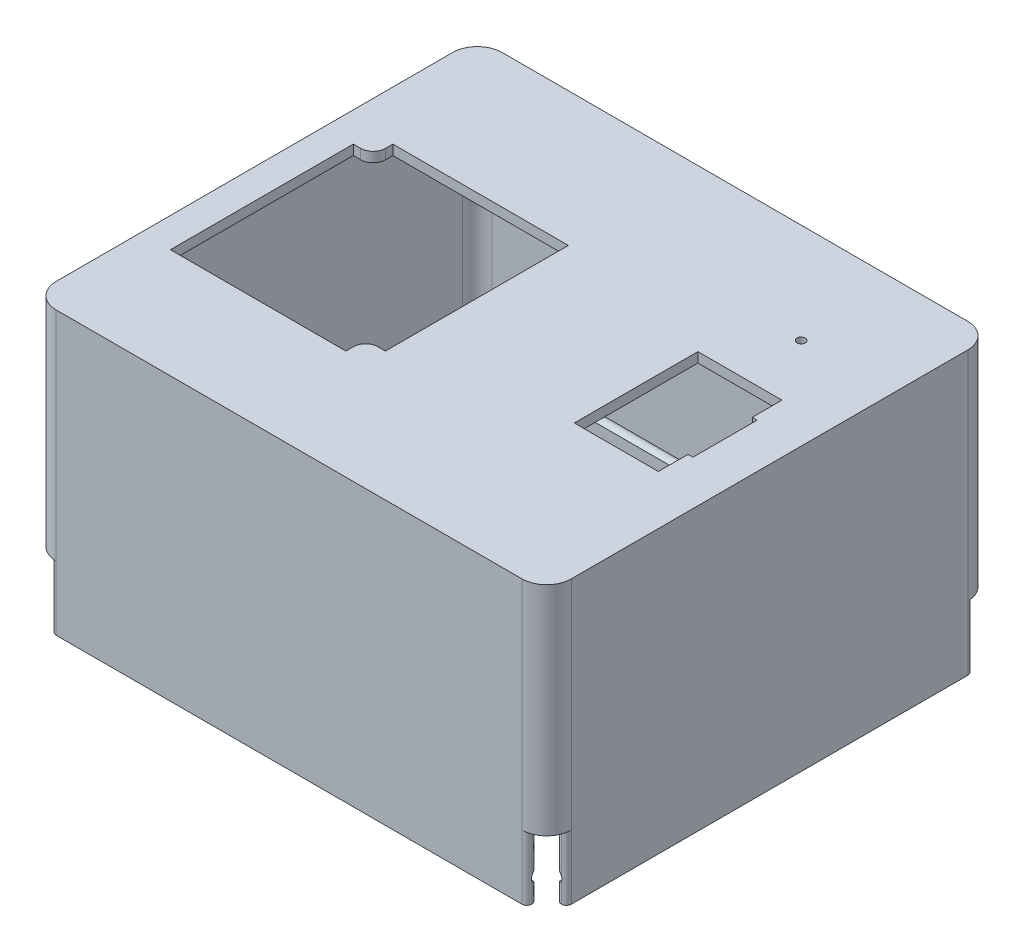
from build123d import *

# Parameters (mm, degrees)
ESQUISSE1_W                     = 104.2
ESQUISSE1_H                     = 90.2
BOSS_EXTRU_1_DEPTH              = 2
ESQUISSE2_W                     = 104.2
ESQUISSE2_H                     = 90.2
ESQUISSE2_W_2                   = 100.2
ESQUISSE2_H_2                   = 86.2
BOSS_EXTRU_2_DEPTH              = 55
ENL_V_MAT_EXTRU_1_DEPTH         = 13
SYM_TRIE2_COPY_1_DEPTH          = 13
CONG_3_R                        = 1
CONG_1_R                        = 5
ENL_V_MAT_EXTRU_2_DEPTH         = 89.167000629
ENL_V_MAT_EXTRU_3_DEPTH         = 89.167000741
ESQUISSE15_W                    = 100.6
ESQUISSE15_H                    = 86.6
ENL_V_MAT_EXTRU_10_DEPTH        = 4.5
ENL_V_MAT_EXTRU_12_REACH        = 90.167
ESQUISSE17_W                    = 39.5
ESQUISSE17_H                    = 41
ESQUISSE19_R                    = 4
BOSS_EXTRU_5_DEPTH              = 9
ESQUISSE20_R                    = 2.05
ENL_V_MAT_EXTRU_13_DEPTH        = 10
R_P_TITION_LIN_AIRE1_COUNT      = 2
R_P_TITION_LIN_AIRE1_PITCH      = 31.8
R_P_TITION_LIN_AIRE1_COUNT_DIR2 = 2
R_P_TITION_LIN_AIRE1_PITCH_DIR2 = 71.5
ENL_V_MAT_EXTRU_16_REACH        = 91.428
ESQUISSE23_W                    = 17
ESQUISSE23_H                    = 25
ENL_V_MAT_EXTRU_17_REACH        = 90.167
ESQUISSE24_R                    = 0.85
ENL_V_MAT_EXTRU_18_REACH        = 91.428
ESQUISSE25_W                    = 1
ESQUISSE25_H                    = 13
ESQUISSE26_W                    = 1.8
ESQUISSE26_H                    = 5.5
ESQUISSE26_W_2                  = 24
ESQUISSE26_H_2                  = 2
ESQUISSE26_W_3                  = 1
BOSS_EXTRU_6_DEPTH              = 2.1
ESQUISSE27_W                    = 5
ESQUISSE27_H                    = 7.5
BOSS_EXTRU_7_DEPTH              = 1.5
BOSS_EXTRU_8_DEPTH              = 2
CONG_4_R                        = 3


with BuildPart() as part:
    # Esquisse1 → Boss.-Extru.1 (new body)
    with BuildSketch(Plane(origin=(0, 0, 0), x_dir=(1, 0, 0), z_dir=(0, 1, 0))):
        Rectangle(ESQUISSE1_W, ESQUISSE1_H)
    extrude(amount=BOSS_EXTRU_1_DEPTH)

    # Esquisse2 → Boss.-Extru.2 (add)
    with BuildSketch(Plane.XZ):
        Rectangle(ESQUISSE2_W, ESQUISSE2_H)
        Rectangle(ESQUISSE2_W_2, ESQUISSE2_H_2, mode=Mode.SUBTRACT)
    extrude(amount=BOSS_EXTRU_2_DEPTH)

    # Esquisse3 → Enlèv. mat.-Extru.1 (cut)
    with BuildSketch(Plane.XZ.offset(55)):
        Polygon((-50.1, 41.1), (-50.1, 43.1), (-48.1, 43.1), (-48.1, 45.1), (-52.1, 45.1), (-52.1, 41.1), align=None)
    enl_v_mat_extru_1 = extrude(amount=-ENL_V_MAT_EXTRU_1_DEPTH, mode=Mode.SUBTRACT)

    # Symétrie1: Enlèv. mat.-Extru.1 across plane
    add(enl_v_mat_extru_1.mirror(Plane.XY), mode=Mode.SUBTRACT)

    # Symétrie2: Enlèv. mat.-Extru.1 across plane
    add(enl_v_mat_extru_1.mirror(Plane(origin=(0, 0, 0), x_dir=(0, 0, 1), z_dir=(1, 0, 0))), mode=Mode.SUBTRACT)

    # Symétrie2 copy 1 sketch → Symétrie2 copy 1 (cut)
    with BuildSketch(Plane(origin=(0, -55, 0), x_dir=(-1, 0, 0), z_dir=(0, -1, 0))):
        Polygon((-50.1, 41.1), (-50.1, 43.1), (-48.1, 43.1), (-48.1, 45.1), (-52.1, 45.1), (-52.1, 41.1), align=None)
    extrude(amount=-SYM_TRIE2_COPY_1_DEPTH, mode=Mode.SUBTRACT)

    # Congé3
    cong_3_edges = [part.edges().sort_by_distance(p)[0] for p in [
        (-48.1, -48.5, 45.1),
        (-48.1, -48.5, 43.1),
        (-50.1, -48.5, 41.1),
        (-52.1, -48.5, 41.1),
        (48.1, -48.5, 45.1),
        (48.1, -48.5, 43.1),
        (52.1, -48.5, 41.1),
        (50.1, -48.5, 41.1),
        (52.1, -48.5, -41.1),
        (50.1, -48.5, -41.1),
        (48.1, -48.5, -43.1),
        (48.1, -48.5, -45.1),
        (-48.1, -48.5, -45.1),
        (-48.1, -48.5, -43.1),
        (-50.1, -48.5, -41.1),
        (-52.1, -48.5, -41.1),
    ]]
    fillet(cong_3_edges, radius=CONG_3_R - 0.0001)  # a hair under: the kernel refuses the full size

    # Congé1
    cong_1_edges = [part.edges().sort_by_distance(p)[0] for p in [
        (52.1, -20, 45.1),
        (52.1, -20, -45.1),
        (-52.1, -20, -45.1),
        (-52.1, -20, 45.1),
    ]]
    fillet(cong_1_edges, radius=CONG_1_R)

    # Esquisse4 → Enlèv. mat.-Extru.2 (cut, symmetric)
    with BuildSketch(Plane(origin=(0, 0, 0), x_dir=(0, 0, -1), z_dir=(1, 0, 0))):
        with BuildLine():
            Line((-43.1, -49.4), (-43.1, -51.6))
            ThreePointArc((-43.1, -51.6), (-44.2, -50.5), (-43.1, -49.4))
        make_face()
    enl_v_mat_extru_2 = extrude(amount=ENL_V_MAT_EXTRU_2_DEPTH, both=True, mode=Mode.SUBTRACT)

    # Symétrie4: Enlèv. mat.-Extru.2 across plane
    add(enl_v_mat_extru_2.mirror(Plane.XY), mode=Mode.SUBTRACT)

    # Esquisse5 → Enlèv. mat.-Extru.3 (cut, symmetric)
    with BuildSketch(Plane.XY):
        with BuildLine():
            Line((-50.1, -49.4), (-50.1, -51.6))
            ThreePointArc((-50.1, -51.6), (-51.2, -50.5), (-50.1, -49.4))
        make_face()
    enl_v_mat_extru_3 = extrude(amount=ENL_V_MAT_EXTRU_3_DEPTH, both=True, mode=Mode.SUBTRACT)

    # Symétrie5: Enlèv. mat.-Extru.3 across plane
    add(enl_v_mat_extru_3.mirror(Plane(origin=(0, 0, 0), x_dir=(0, 0, 1), z_dir=(1, 0, 0))), mode=Mode.SUBTRACT)

    # Esquisse15 → Enlèv. mat.-Extru.10 (cut)
    with BuildSketch(Plane.XZ.offset(55)):
        Rectangle(ESQUISSE15_W, ESQUISSE15_H)
    extrude(amount=-ENL_V_MAT_EXTRU_10_DEPTH, mode=Mode.SUBTRACT)

    # Esquisse17 → Enlèv. mat.-Extru.12 (cut, up to next)
    with BuildSketch(Plane.XZ, mode=Mode.PRIVATE) as enl_v_mat_extru_12_sk1:
        with Locations((-26.35, 2.5)):
            Rectangle(ESQUISSE17_W, ESQUISSE17_H)
    enl_v_mat_extru_12_tool1 = extrude(enl_v_mat_extru_12_sk1.sketch, amount=-ENL_V_MAT_EXTRU_12_REACH, mode=Mode.PRIVATE) & part.part
    add(enl_v_mat_extru_12_tool1.solids().sort_by_distance((-26.35, 0, 2.5))[0], mode=Mode.SUBTRACT)

    # Esquisse19 → Boss.-Extru.5 (add)
    with BuildSketch(Plane.XZ):
        with Locations(Location((-43.1, 33, 0), (0, 0, 270))):
            Circle(ESQUISSE19_R)
        with Locations(Location((-43.1, -38.5, 0), (0, 0, 270))):
            Circle(ESQUISSE19_R)
        with Locations(Location((-11.3, 33, 0), (0, 0, 270))):
            Circle(ESQUISSE19_R)
        with Locations(Location((-11.3, -38.5, 0), (0, 0, 270))):
            Circle(ESQUISSE19_R)
    extrude(amount=BOSS_EXTRU_5_DEPTH)

    # Esquisse20 → Enlèv. mat.-Extru.13 (cut)
    with BuildSketch(Plane.XZ.offset(9)):
        with Locations(Location((-43.1, 33, 0), (0, 0, 270))):
            Circle(ESQUISSE20_R)
    enl_v_mat_extru_13 = extrude(amount=-ENL_V_MAT_EXTRU_13_DEPTH, mode=Mode.SUBTRACT)

    # Répétition linéaire1: Enl_v. mat.-Extru.13 2 × 2
    with Locations(*[(i * R_P_TITION_LIN_AIRE1_PITCH, 0, -j * R_P_TITION_LIN_AIRE1_PITCH_DIR2) for i in range(R_P_TITION_LIN_AIRE1_COUNT) for j in range(R_P_TITION_LIN_AIRE1_COUNT_DIR2) if (i, j) != (0, 0)]):
        add(enl_v_mat_extru_13, mode=Mode.SUBTRACT)

    # Esquisse23 → Enlèv. mat.-Extru.16 (cut, up to next)
    with BuildSketch(Plane(origin=(0, 2, 0), x_dir=(1, 0, 0), z_dir=(0, 1, 0)), mode=Mode.PRIVATE) as enl_v_mat_extru_16_sk1:
        with Locations((33.6, 0)):
            Rectangle(ESQUISSE23_W, ESQUISSE23_H)
    enl_v_mat_extru_16_tool1 = extrude(enl_v_mat_extru_16_sk1.sketch, amount=-ENL_V_MAT_EXTRU_16_REACH, mode=Mode.PRIVATE) & part.part
    add(enl_v_mat_extru_16_tool1.solids().sort_by_distance((33.6, 2, 0))[0], mode=Mode.SUBTRACT)

    # Esquisse24 → Enlèv. mat.-Extru.17 (cut, up to next)
    with BuildSketch(Plane.XZ, mode=Mode.PRIVATE) as enl_v_mat_extru_17_sk1:
        with Locations(Location((33.6, -24.9, 0), (0, 0, 270))):
            Circle(ESQUISSE24_R)
    enl_v_mat_extru_17_tool1 = extrude(enl_v_mat_extru_17_sk1.sketch, amount=-ENL_V_MAT_EXTRU_17_REACH, mode=Mode.PRIVATE) & part.part
    add(enl_v_mat_extru_17_tool1.solids().sort_by_distance((33.6, 0, -24.9))[0], mode=Mode.SUBTRACT)

    # Esquisse25 → Enlèv. mat.-Extru.18 (cut, up to next)
    with BuildSketch(Plane(origin=(0, 2, 0), x_dir=(1, 0, 0), z_dir=(0, 1, 0)), mode=Mode.PRIVATE) as enl_v_mat_extru_18_sk1:
        with Locations((42.6, 0)):
            Rectangle(ESQUISSE25_W, ESQUISSE25_H)
    enl_v_mat_extru_18_tool1 = extrude(enl_v_mat_extru_18_sk1.sketch, amount=-ENL_V_MAT_EXTRU_18_REACH, mode=Mode.PRIVATE) & part.part
    add(enl_v_mat_extru_18_tool1.solids().sort_by_distance((42.6, 2, 0))[0], mode=Mode.SUBTRACT)

    # Esquisse26 → Boss.-Extru.6 (add)
    with BuildSketch(Plane.XZ):
        with Locations((22.5, 13.25)):
            Rectangle(ESQUISSE26_W, ESQUISSE26_H)
        with Locations((33.6, 17)):
            Rectangle(ESQUISSE26_W_2, ESQUISSE26_H_2)
        with Locations((45.1, 13.25)):
            Rectangle(ESQUISSE26_W_3, ESQUISSE26_H)
    extrude(amount=BOSS_EXTRU_6_DEPTH)

    # Esquisse27 → Boss.-Extru.7 (add)
    with BuildSketch(Plane.XZ.offset(2.1)):
        with Locations((24.1, 14.25)):
            Rectangle(ESQUISSE27_W, ESQUISSE27_H)
        with Locations((43.1, 14.25)):
            Rectangle(ESQUISSE27_W, ESQUISSE27_H)
    extrude(amount=BOSS_EXTRU_7_DEPTH)

    # Esquisse28 → Boss.-Extru.8 (add)
    with BuildSketch(Plane.XZ):
        with BuildLine():
            Line((-6.6, 23), (-10.6, 23))
            Line((-10.6, 23), (-10.6, 21.5))
            ThreePointArc((-10.6, 21.5), (-9.867766953, 19.732233047), (-8.1, 19))
            Line((-8.1, 19), (-6.6, 19))
            Line((-6.6, 19), (-6.6, 23))
        make_face()
        with BuildLine():
            Line((-46.1, -18), (-42.1, -18))
            Line((-42.1, -18), (-42.1, -16.5))
            ThreePointArc((-42.1, -16.5), (-42.832233047, -14.732233047), (-44.6, -14))
            Line((-44.6, -14), (-46.1, -14))
            Line((-46.1, -14), (-46.1, -18))
        make_face()
    extrude(amount=-BOSS_EXTRU_8_DEPTH)

    # Congé4
    cong_4_edges = [part.edges().sort_by_distance(p)[0] for p in [
        (-50.1, -21, -43.1),
        (50.1, -21, -43.1),
        (50.1, -21, 43.1),
        (-50.1, -21, 43.1),
    ]]
    fillet(cong_4_edges, radius=CONG_4_R - 0.0001)  # a hair under: the kernel refuses the full size


solid = part.part
